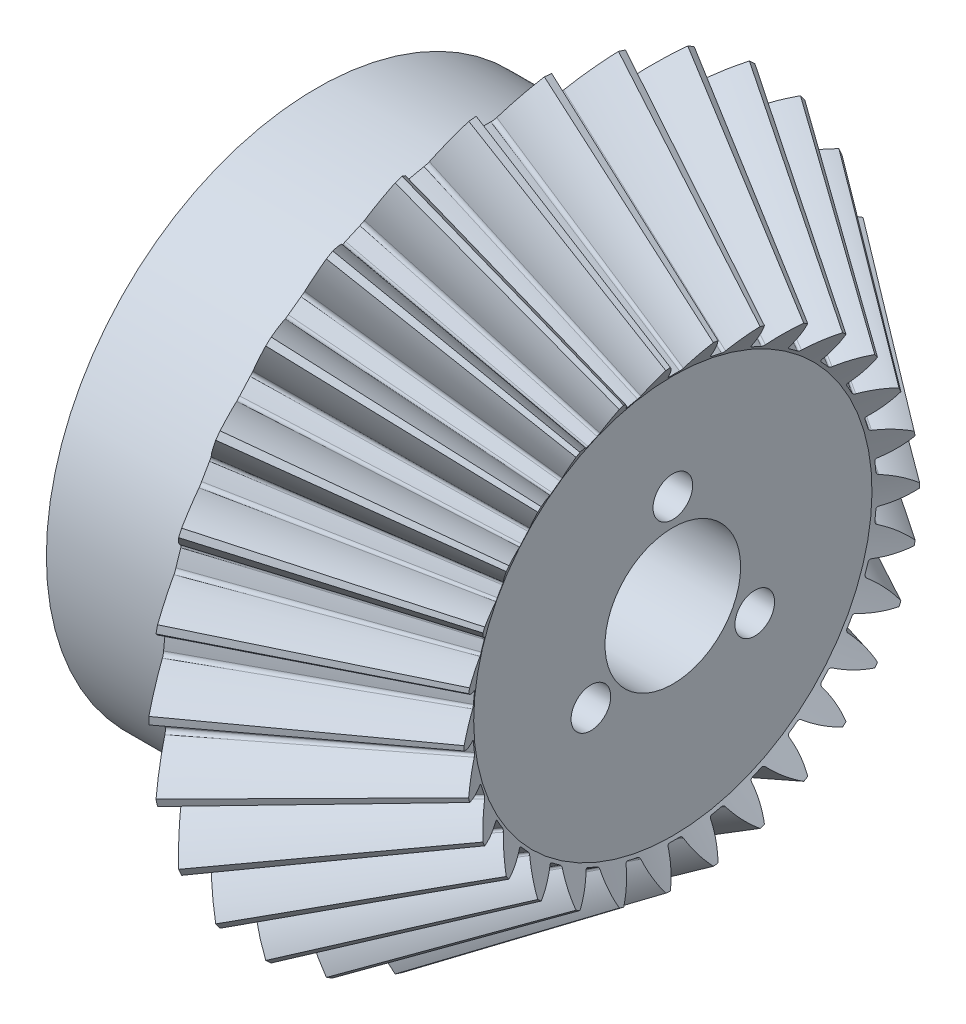
from build123d import *

# Parameters (mm, degrees)
TEETHCUTS_COUNT    = 30
TEETHCUTS_ANGLE    = 348
HUBSKE_R           = 30
HUB_DEPTH          = 18.133073486
BORSKE_R           = 3
BORE_DEPTH         = 76.0000508
SKETCH1_R          = 2.2
CUT_EXTRUDE1_DEPTH = 70.038905627
SKETCH2_R          = 7.525
CUT_EXTRUDE2_DEPTH = 70.038905627


with BuildPart() as part:
    # BasProSke → Base-Revolve (revolve)
    with BuildSketch(Plane(origin=(0, 0, 0), x_dir=(1, 0, 0), z_dir=(0, 1, 0)), mode=Mode.PRIVATE) as base_revolve_sk:
        Polygon((0, 0), (0, 35.074457831), (3.3581704, 40.111713423), (23.515553104, 25.278396537), (21.399234558, 22.103918723), (21.399234558, 0), align=None)
    revolve(base_revolve_sk.sketch.rotate(Axis((-10, 0, 0), (1, 0, 0)), 180), axis=Axis((-10, 0, 0), (1, 0, 0)))

    # ToothCut: read off the stored shape, not the designer's step
    # ToothCut: loft between two sections, ruled curve by curve
    toothcut_from = [
        Edge.make_bspline([(57.871713134, 0.007027529, -0.009484391), (57.868395092, 0.002050465, -0.014811229), (57.863976618, -0.004577246, -0.013970807), (57.861348277, -0.008519758, -0.007512929)], [0, 0, 0, 0, 1, 1, 1, 1], 3, [1, 0.781933424, 0.781933424, 1]),
        Edge.make_bspline([(57.861348277, -0.008519758, 0.007512929), (57.863976618, -0.004577246, 0.013970807), (57.868395092, 0.002050465, 0.014811229), (57.871713134, 0.007027529, 0.009484391)], [0, 0, 0, 0, 1, 1, 1, 1], 3, [1, 0.781933424, 0.781933424, 1]),
        Edge.make_bspline([(57.861348277, -0.008519758, -0.007512929), (57.86099964, -0.009042713, -0.006656321), (57.860713045, -0.009472606, -0.005727955), (57.860492976, -0.009802709, -0.004742354)], [0, 0, 0, 0, 1, 1, 1, 1], 3, [1, 0.994785241, 0.994785241, 1]),
        Edge.make_bspline([(57.860492976, -0.009802709, 0.004742354), (57.860713045, -0.009472606, 0.005727955), (57.86099964, -0.009042713, 0.006656321), (57.861348277, -0.008519758, 0.007512929)], [0, 0, 0, 0, 1, 1, 1, 1], 3, [1, 0.994785241, 0.994785241, 1]),
        Edge.make_bspline([(57.860492976, -0.009802709, -0.004742354), (57.859804932, -0.010834775, -0.001660878), (57.859804932, -0.010834775, 0.001660878), (57.860492976, -0.009802709, 0.004742354)], [0, 0, 0, 0, 1, 1, 1, 1], 3, [1, 0.951776612, 0.951776612, 1]),
        Edge.make_line((57.871713134, 0.007027529, 0.009484391), (57.871713134, 0.007027529, -0.009484391)),
    ]
    toothcut_to = [
        Edge.make_bspline([(3.680801317, 40.595659797, -4.371429588), (2.754803095, 39.206662467, -2.951006948), (1.68062342, 37.595392957, -1.924198614), (0.508858003, 35.837744834, -1.339369024)], [0, 0, 0, 0, 1, 1, 1, 1], 3, [1, 0.984299426, 0.984299426, 1]),
        Edge.make_bspline([(0.508858003, 35.837744834, 1.339369024), (1.68062342, 37.595392957, 1.924198614), (2.754803095, 39.206662467, 2.951006948), (3.680801317, 40.595659797, 4.371429588)], [0, 0, 0, 0, 1, 1, 1, 1], 3, [1, 0.984299426, 0.984299426, 1]),
        Edge.make_bspline([(0.508858003, 35.837744834, -1.339369024), (0.388597218, 35.657353657, -1.279346716), (0.314283719, 35.545883408, -1.098630922), (0.317383975, 35.550533792, -0.873741898)], [0, 0, 0, 0, 1, 1, 1, 1], 3, [1, 0.858857096, 0.858857096, 1]),
        Edge.make_bspline([(0.317383975, 35.550533792, 0.873741898), (0.314283719, 35.545883408, 1.098630922), (0.388597218, 35.657353657, 1.279346716), (0.508858003, 35.837744834, 1.339369024)], [0, 0, 0, 0, 1, 1, 1, 1], 3, [1, 0.858857096, 0.858857096, 1]),
        Edge.make_bspline([(0.317383975, 35.550533792, -0.873741898), (0.325413252, 35.562577708, -0.291307247), (0.325413252, 35.562577708, 0.291307247), (0.317383975, 35.550533792, 0.873741898)], [0, 0, 0, 0, 1, 1, 1, 1], 3, [1, 0.999794212, 0.999794212, 1]),
        Edge.make_line((3.680801317, 40.595659797, 4.371429588), (3.680801317, 40.595659797, -4.371429588)),
    ]
    toothcut = Solid(Shell([*[Face.make_surface_from_curves(toothcut_from[k], toothcut_to[k]) for k in range(6)], Face(Wire(toothcut_from)), Face(Wire(toothcut_to))]))
    add(toothcut, mode=Mode.SUBTRACT)

    # TeethCuts: ToothCut ×30 about axis
    teethcuts_axis = Axis((-10, 0, 0), (1, 0, 0))
    for i in range(1, TEETHCUTS_COUNT):
        add(toothcut.rotate(teethcuts_axis, i * TEETHCUTS_ANGLE / (TEETHCUTS_COUNT - 1)), mode=Mode.SUBTRACT)

    # HubSke → Hub (add)
    with BuildSketch(Plane.ZY):
        with Locations(Location((0, 0, 0), (0, 0, 180))):
            Circle(HUBSKE_R)
    extrude(amount=HUB_DEPTH)

    # BorSke → Bore (cut, symmetric)
    with BuildSketch(Plane(origin=(0, 0, 0), x_dir=(0, 0, -1), z_dir=(1, 0, 0))):
        with Locations(Location((0, 0, 0), (0, 0, 180))):
            Circle(BORSKE_R)
    extrude(amount=BORE_DEPTH, both=True, mode=Mode.SUBTRACT)

    # Sketch1 → Cut-Extrude1 (cut, through all)
    with BuildSketch(Plane(origin=(21.399234558, 0, 0), x_dir=(0, 0, -1), z_dir=(1, 0, 0))):
        with Locations((-9.09326674, -5.25)):
            Circle(SKETCH1_R)
        with Locations((0, 10.5)):
            Circle(SKETCH1_R)
        with Locations((9.09326674, -5.25)):
            Circle(SKETCH1_R)
    extrude(amount=-CUT_EXTRUDE1_DEPTH, mode=Mode.SUBTRACT)

    # Sketch2 → Cut-Extrude2 (cut, through all)
    with BuildSketch(Plane(origin=(21.399234558, 0, 0), x_dir=(0, 0, -1), z_dir=(1, 0, 0))):
        Circle(SKETCH2_R)
    extrude(amount=-CUT_EXTRUDE2_DEPTH, mode=Mode.SUBTRACT)


solid = part.part
